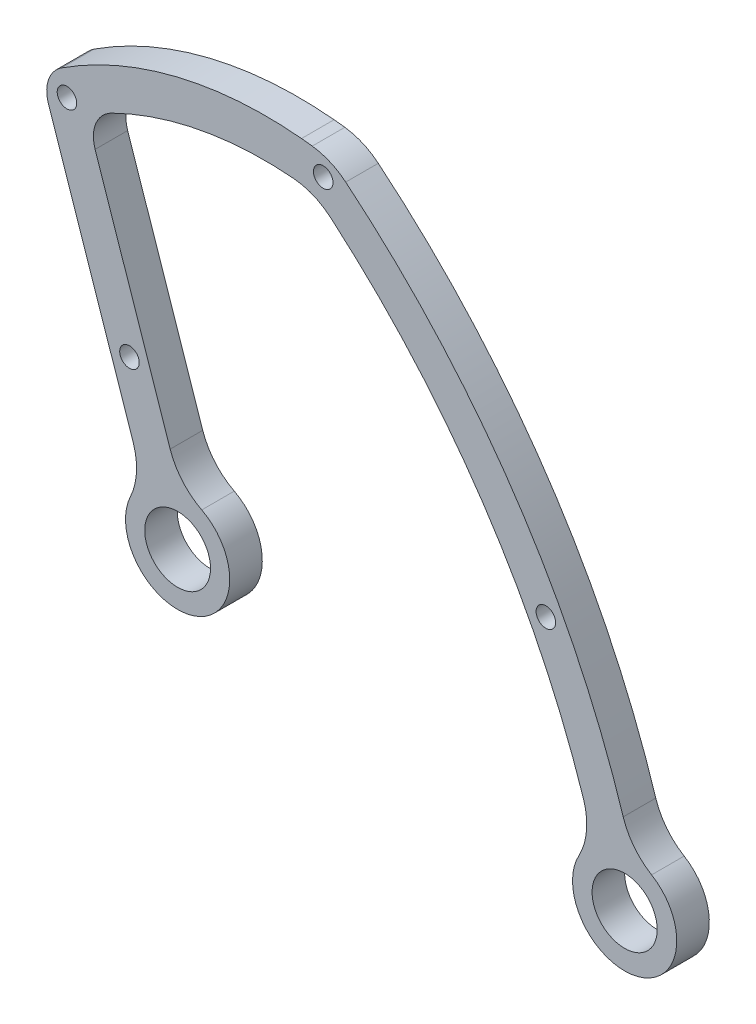
from build123d import *

# Parameters (mm, degrees)
SKETCH_2_R      = 1.5
SKETCH_2_R_2    = 5.05
SKETCH_2_R_3    = 1.500000001
SKETCH_2_R_4    = 5
EXTRUDE_1_DEPTH = 5


with BuildPart() as part:
    # ｽｹｯﾁ2 → ﾎﾞｽ - 押し出し1 (new body)
    with BuildSketch(Plane.XY):
        with BuildLine():
            Line((-103.472140065, 101.974881276), (-90.465628325, 63.493979587))
            ThreePointArc((-90.465628325, 63.493979587), (-89.954765024, 59.732746642), (-90.882432701, 56.052082673))
            ThreePointArc((-90.882432701, 56.052082673), (-81.075459946, 45.081398796), (-79.93528971, 59.752207608))
            ThreePointArc((-79.93528971, 59.752207608), (-82.905745012, 62.115309356), (-84.781534849, 65.415198302))
            Line((-84.781534849, 65.415198302), (-96.306113117, 99.511670303))
            ThreePointArc((-96.306113117, 99.511670303), (-96.187159058, 103.029978486), (-93.779139917, 105.597873802))
            ThreePointArc((-93.779139917, 105.597873802), (-80.151317429, 110.147426191), (-65.802869152, 110.880914253))
            ThreePointArc((-65.802869152, 110.880914253), (-62.79775687, 110.146159795), (-60.161017961, 108.5280832))
            ThreePointArc((-60.161017961, 108.5280832), (-36.743622956, 82.25702049), (-21.311725155, 50.627925419))
            ThreePointArc((-21.311725155, 50.627925419), (-20.854856748, 46.607677814), (-22.028392426, 42.735477722))
            ThreePointArc((-22.028392426, 42.735477722), (-12.907537143, 31.192758259), (-10.862618787, 45.76130941))
            ThreePointArc((-10.862618787, 45.76130941), (-13.545428623, 48.130915345), (-15.221875918, 51.293513228))
            ThreePointArc((-15.221875918, 51.293513228), (-31.975045674, 85.917727287), (-57.825293588, 114.400521722))
            ThreePointArc((-57.825293588, 114.400521722), (-60.237672636, 115.875551964), (-62.966502644, 116.616344564))
            ThreePointArc((-62.966502644, 116.616344564), (-63.790868964, 116.71275987), (-64.616469841, 116.797959233))
            ThreePointArc((-64.616469841, 116.797959233), (-83.80595381, 115.410758879), (-101.461958419, 107.767060751))
            ThreePointArc((-101.461958419, 107.767060751), (-103.45901439, 105.215233505), (-103.472140065, 101.974881276))
        make_face()
        with Locations((-100.624843057, 104.231631526)):
            Circle(SKETCH_2_R, mode=Mode.SUBTRACT)
        with Locations((-61.284609553, 113.347883242)):
            Circle(SKETCH_2_R, mode=Mode.SUBTRACT)
        with Locations((-91.031859186, 74.538276088)):
            Circle(SKETCH_2_R, mode=Mode.SUBTRACT)
        with Locations((-83.637084901, 52.660190097)):
            Circle(SKETCH_2_R_2, mode=Mode.SUBTRACT)
        with Locations((-27.094783201, 71.932184414)):
            Circle(SKETCH_2_R_3, mode=Mode.SUBTRACT)
        with Locations((-15, 38.914260651)):
            Circle(SKETCH_2_R_4, mode=Mode.SUBTRACT)
    extrude(amount=EXTRUDE_1_DEPTH)


solid = part.part
